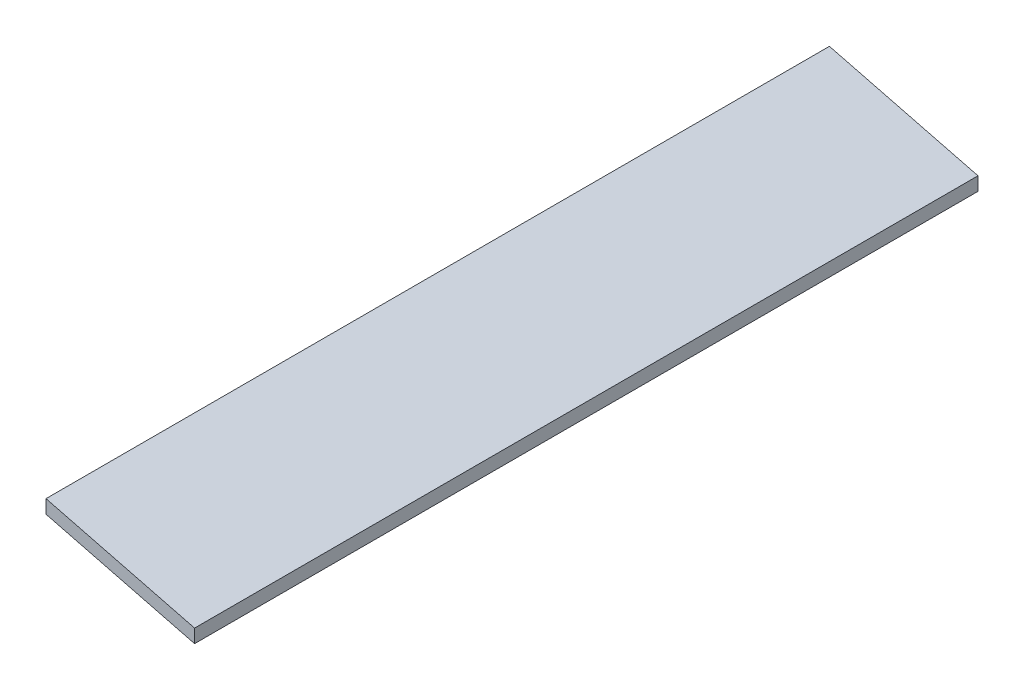
from build123d import *

# Parameters (mm, degrees)
BOSS_EXTRU_1_DEPTH = 580


with BuildPart() as part:
    # Esquisse1 → Boss.-Extru.1 (new body)
    with BuildSketch(Plane.XY):
        Polygon((120, 155), (10, 183), (10, 173), (120, 145), align=None)
    extrude(amount=-BOSS_EXTRU_1_DEPTH)


solid = part.part
